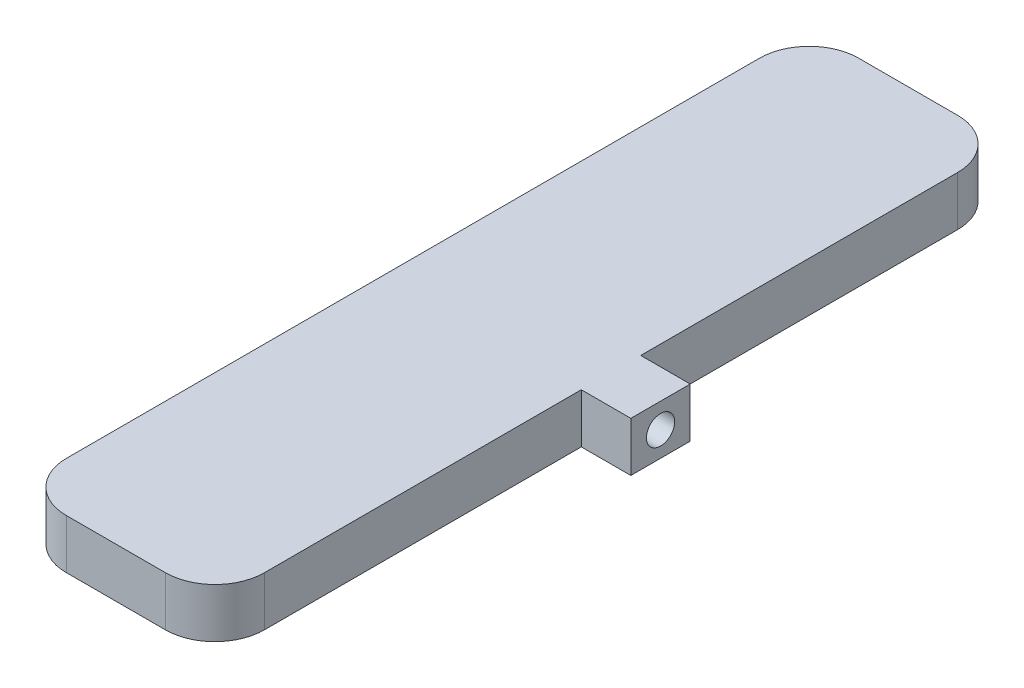
from build123d import *

# Parameters (mm, degrees)
SKETCH1_W           = 20
SKETCH1_H           = 80
BOSS_EXTRUDE1_DEPTH = 5
FILLET1_R           = 5
SHELL1_T            = -2
SKETCH2_W           = 6
SKETCH2_H           = 5
BOSS_EXTRUDE2_DEPTH = 5
SKETCH3_R           = 1.425
CUT_EXTRUDE1_DEPTH  = 4


with BuildPart() as part:
    # Sketch1 → Boss-Extrude1 (new body)
    with BuildSketch(Plane(origin=(0, 0, 0), x_dir=(1, 0, 0), z_dir=(0, 1, 0))):
        Rectangle(SKETCH1_W, SKETCH1_H)
    extrude(amount=BOSS_EXTRUDE1_DEPTH)

    # Fillet1
    fillet1_edges = [part.edges().sort_by_distance(p)[0] for p in [
        (-10, 2.5, -40),
        (10, 2.5, -40),
        (-10, 2.5, 40),
        (10, 2.5, 40),
    ]]
    fillet(fillet1_edges, radius=FILLET1_R)

    # Shell1
    shell1_openings = [part.faces().sort_by_distance(p)[0] for p in [
        (0, 0, 0),
    ]]
    offset(amount=SHELL1_T, openings=shell1_openings, kind=Kind.INTERSECTION)

    # Sketch2 → Boss-Extrude2 (add)
    with BuildSketch(Plane(origin=(10, 0, 0), x_dir=(0, 0, -1), z_dir=(1, 0, 0))):
        with Locations((0, 2.5)):
            Rectangle(SKETCH2_W, SKETCH2_H)
    extrude(amount=BOSS_EXTRUDE2_DEPTH)

    # Sketch3 → Cut-Extrude1 (cut)
    with BuildSketch(Plane(origin=(15, 0, 0), x_dir=(0, 0, -1), z_dir=(1, 0, 0))):
        with Locations((0, 2.5)):
            Circle(SKETCH3_R)
    extrude(amount=-CUT_EXTRUDE1_DEPTH, mode=Mode.SUBTRACT)


solid = part.part
